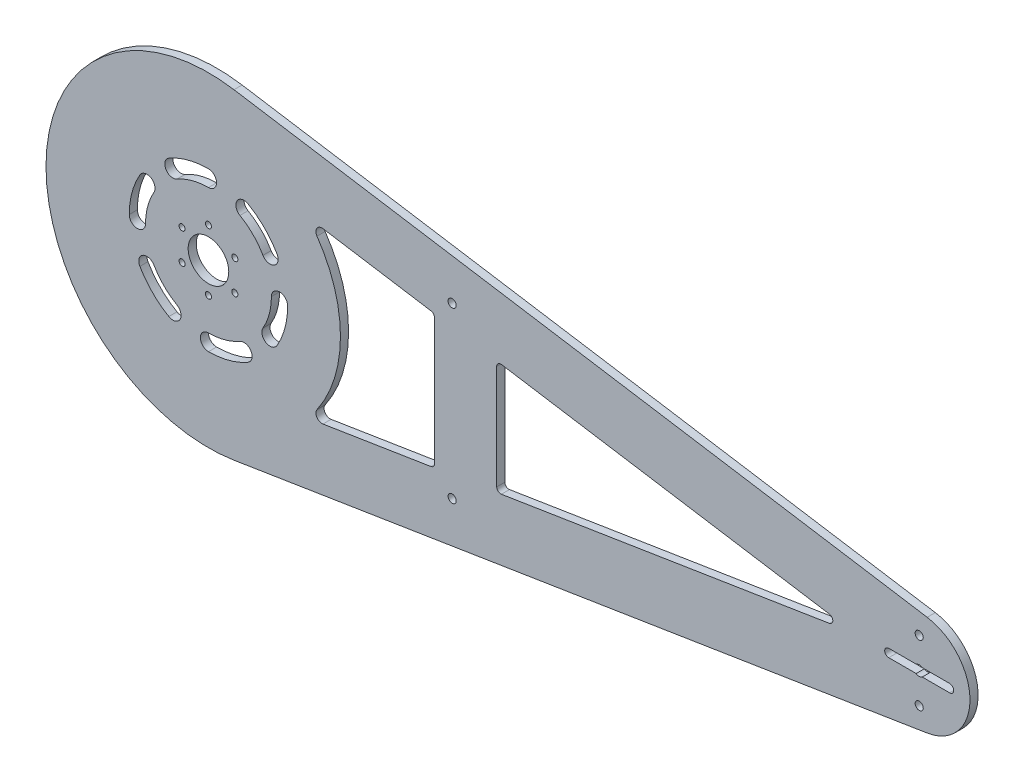
from build123d import *

# Parameters (mm, degrees)
SM_BASE_FLANGE_1_DEPTH = 4
SKETCH_6_R             = 10
SKETCH_6_R_2           = 2.5
CUT_EXTRUDE_1_DEPTH    = 10
SKETCH_7_R             = 2
CUT_EXTRUDE_2_DEPTH    = 10
CUT_EXTRUDE_3_DEPTH    = 10
SKETCH_9_R             = 2
CUT_EXTRUDE_4_DEPTH    = 80
FILLET_2_R             = 2
SKETCH_10_R            = 1.5
CUT_EXTRUDE_5_DEPTH    = 4


# Sheet-metal steps are written as plain solids
with BuildPart() as part:
    # Sketch 1 → 基体-法兰1 (new body)
    with BuildSketch(Plane.XY):
        with BuildLine():
            Line((12.571428571, 79.00607055), (353.928571429, 24.689397047))
            ThreePointArc((353.928571429, 24.689397047), (375, 0), (353.928571429, -24.689397047))
            Line((353.928571429, -24.689397047), (12.571428571, -79.00607055))
            ThreePointArc((12.571428571, -79.00607055), (-80, 0), (12.571428571, 79.00607055))
        make_face()
    extrude(amount=-SM_BASE_FLANGE_1_DEPTH)

    # 草图6 → 切除-拉伸1 (cut)
    with BuildSketch(Plane.XY):
        Circle(SKETCH_6_R)
        with Locations((350, 0)):
            Circle(SKETCH_6_R_2)
    extrude(amount=-CUT_EXTRUDE_1_DEPTH, mode=Mode.SUBTRACT)

    # 草图7 → 切除-拉伸2 (cut)
    with BuildSketch(Plane.XY):
        with Locations((365, 0)):
            Circle(SKETCH_7_R)
        with Locations((350, -15)):
            Circle(SKETCH_7_R)
        with Locations((335, 0)):
            Circle(SKETCH_7_R)
        with Locations((350, 15)):
            Circle(SKETCH_7_R)
        with BuildLine():
            Line((111.294862901, 32.919806827), (111.294862901, -32.919806827))
            Line((111.294862901, -32.919806827), (56.389238276, -41.656377743))
            ThreePointArc((56.389238276, -41.656377743), (53.378656764, -40.291367953), (53.450847511, -36.986577299))
            ThreePointArc((53.450847511, -36.986577299), (62.032293151, -19.416348946), (64.999939097, -0.088979461))
            ThreePointArc((64.999939097, -0.088979461), (62.058814357, 19.33141383), (53.450847511, 36.986577299))
            ThreePointArc((53.450847511, 36.986577299), (53.378656764, 40.291367953), (56.389238276, 41.656377743))
            Line((56.389238276, 41.656377743), (111.294862901, 32.919806827))
        make_face()
        Polygon((141.940088648, 28.043545246), (141.940088648, -28.043545246), (318.181818182, 0), align=None)
        with BuildLine():
            ThreePointArc((0, 39), (-10.093942759, 37.671107225), (-19.5, 33.774990748))
            ThreePointArc((-19.5, 33.774990748), (-20.964101615, 28.310889132), (-15.5, 26.846787517))
            ThreePointArc((-15.5, 26.846787517), (-8.023390398, 29.943700615), (0, 31))
            ThreePointArc((0, 31), (4, 35), (0, 39))
        make_face()
        with BuildLine():
            ThreePointArc((26.846787517, 15.5), (21.920310217, 21.920310217), (15.5, 26.846787517))
            ThreePointArc((15.5, 26.846787517), (14.035898385, 32.310889132), (19.5, 33.774990748))
            ThreePointArc((19.5, 33.774990748), (27.577164466, 27.577164466), (33.774990748, 19.5))
            ThreePointArc((33.774990748, 19.5), (32.310889132, 14.035898385), (26.846787517, 15.5))
        make_face()
        with BuildLine():
            ThreePointArc((26.846787517, -15.5), (29.943700615, -8.023390398), (31, 0))
            ThreePointArc((31, 0), (35, 4), (39, 0))
            ThreePointArc((39, 0), (37.671107225, -10.093942759), (33.774990748, -19.5))
            ThreePointArc((33.774990748, -19.5), (28.310889132, -20.964101615), (26.846787517, -15.5))
        make_face()
        with BuildLine():
            ThreePointArc((0, -31), (8.023390398, -29.943700615), (15.5, -26.846787517))
            ThreePointArc((15.5, -26.846787517), (20.964101615, -28.310889132), (19.5, -33.774990748))
            ThreePointArc((19.5, -33.774990748), (10.093942759, -37.671107225), (0, -39))
            ThreePointArc((0, -39), (-4, -35), (0, -31))
        make_face()
        with BuildLine():
            ThreePointArc((-26.846787517, -15.5), (-21.920310217, -21.920310217), (-15.5, -26.846787517))
            ThreePointArc((-15.5, -26.846787517), (-14.035898385, -32.310889132), (-19.5, -33.774990748))
            ThreePointArc((-19.5, -33.774990748), (-27.577164466, -27.577164466), (-33.774990748, -19.5))
            ThreePointArc((-33.774990748, -19.5), (-32.310889132, -14.035898385), (-26.846787517, -15.5))
        make_face()
        with BuildLine():
            ThreePointArc((-26.846787517, 15.5), (-29.943700615, 8.023390398), (-31, 0))
            ThreePointArc((-31, 0), (-35, -4), (-39, 0))
            ThreePointArc((-39, 0), (-37.671107225, 10.093942759), (-33.774990748, 19.5))
            ThreePointArc((-33.774990748, 19.5), (-28.310889132, 20.964101615), (-26.846787517, 15.5))
        make_face()
    extrude(amount=-CUT_EXTRUDE_2_DEPTH, mode=Mode.SUBTRACT)

    # 草图8 → 切除-拉伸3 (cut)
    with BuildSketch(Plane.XY):
        with BuildLine():
            Line((347.5, 0), (337, 0))
            ThreePointArc((337, 0), (336.414213562, -1.414213562), (335, -2))
            Line((335, -2), (348.5, -2))
            ThreePointArc((348.5, -2), (347.763932023, -1.118033989), (347.5, 0))
        make_face()
        with BuildLine():
            ThreePointArc((335, 2), (336.414213562, 1.414213562), (337, 0))
            Line((337, 0), (347.5, 0))
            ThreePointArc((347.5, 0), (347.763932023, 1.118033989), (348.5, 2))
            Line((348.5, 2), (335, 2))
        make_face()
        with BuildLine():
            ThreePointArc((351.5, 2), (352.236067977, 1.118033989), (352.5, 0))
            Line((352.5, 0), (363, 0))
            ThreePointArc((363, 0), (363.585786438, 1.414213562), (365, 2))
            Line((365, 2), (351.5, 2))
        make_face()
        with BuildLine():
            Line((363, 0), (352.5, 0))
            ThreePointArc((352.5, 0), (352.236067977, -1.118033989), (351.5, -2))
            Line((351.5, -2), (365, -2))
            ThreePointArc((365, -2), (363.585786438, -1.414213562), (363, 0))
        make_face()
    extrude(amount=-CUT_EXTRUDE_3_DEPTH, mode=Mode.SUBTRACT)

    # 草图9 → 切除-拉伸4 (cut)
    with BuildSketch(Plane.XY):
        with Locations((120, 41.660451514)):
            Circle(SKETCH_9_R)
        with Locations((120, -41.660451514)):
            Circle(SKETCH_9_R)
    extrude(amount=-CUT_EXTRUDE_4_DEPTH, mode=Mode.SUBTRACT)

    # 圆角2
    fillet_2_edges = [part.edges().sort_by_distance(p)[0] for p in [
        (111.294862901, 32.919806827, -2),
        (111.294862901, -32.919806827, -2),
        (141.940088648, 28.043545246, -2),
        (318.181818182, 0, -2),
        (141.940088648, -28.043545246, -2),
    ]]
    fillet(fillet_2_edges, radius=FILLET_2_R)

    # 草图10 → 切除-拉伸5 (cut)
    with BuildSketch(Plane.XY):
        with Locations((0, 15)):
            Circle(SKETCH_10_R)
        with Locations((12.990381057, 7.5)):
            Circle(SKETCH_10_R)
        with Locations((12.990381057, -7.5)):
            Circle(SKETCH_10_R)
        with Locations((0, -15)):
            Circle(SKETCH_10_R)
        with Locations((-12.990381057, -7.5)):
            Circle(SKETCH_10_R)
        with Locations((-12.990381057, 7.5)):
            Circle(SKETCH_10_R)
    extrude(amount=-CUT_EXTRUDE_5_DEPTH, mode=Mode.SUBTRACT)


solid = part.part
